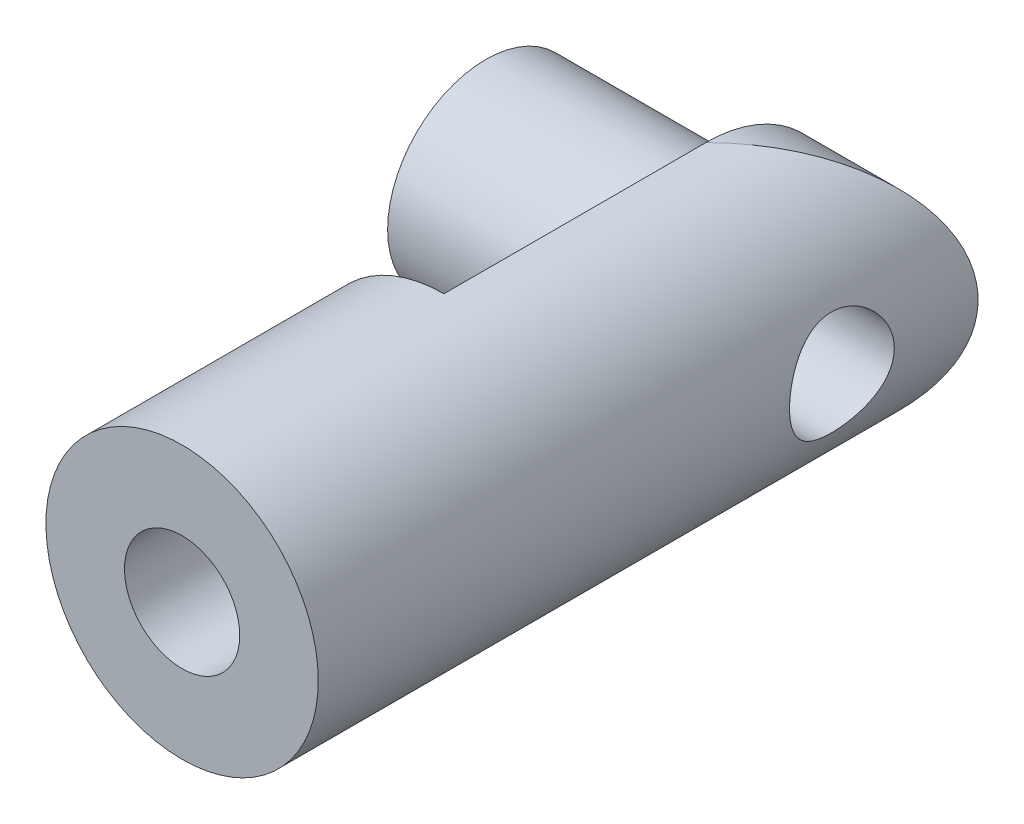
from build123d import *

# Parameters (mm, degrees)
SKETCH8_R                = 2.6
SKETCH8_R_2              = 1.1
BOSS_EXTRUDE2_DEPTH      = 5
BOSS_EXTRUDE3_REACH      = 8.206
BOSS_EXTRUDE3_END_RADIUS = 2.6
SKETCH10_R               = 1.875
BOSS_EXTRUDE4_DEPTH      = 4.2
SKETCH11_R               = 1
CUT_EXTRUDE1_DEPTH       = 11.524257694


with BuildPart() as part:
    # Sketch8 → Boss-Extrude2 (new body)
    with BuildSketch(Plane.XY):
        Circle(SKETCH8_R)
        Circle(SKETCH8_R_2, mode=Mode.SUBTRACT)
    extrude(amount=BOSS_EXTRUDE2_DEPTH)

    # Boss-Extrude3: up to this cylinder (the profile starts inside it)
    boss_extrude3_end = Plane(origin=(0, 0, -3.544928), z_dir=(0, 0, -1)) * Cylinder(BOSS_EXTRUDE3_END_RADIUS, 22.612, mode=Mode.PRIVATE)
    # Sketch9 → Boss-Extrude3 (add, up to the surface)
    with BuildSketch(Plane(origin=(0, 0, 0), x_dir=(0, 0, -1), z_dir=(1, 0, 0)), mode=Mode.PRIVATE) as boss_extrude3_sk1:
        with BuildLine():
            Line((0, 2.6), (5, 2.6))
            ThreePointArc((5, 2.6), (7.6, 0), (5, -2.6))
            Line((5, -2.6), (0, -2.6))
            Line((0, -2.6), (0, 2.6))
        make_face()
    boss_extrude3_tool1 = extrude(boss_extrude3_sk1.sketch, amount=BOSS_EXTRUDE3_REACH, mode=Mode.PRIVATE) & boss_extrude3_end
    add(boss_extrude3_tool1.solids().sort_by_distance((0, 0, -3.544928))[0])

    # Sketch10 → Boss-Extrude4 (add)
    with BuildSketch(Plane.ZY):
        with Locations((-5, 0)):
            Circle(SKETCH10_R)
    extrude(amount=BOSS_EXTRUDE4_DEPTH)

    # Sketch11 → Cut-Extrude1 (cut, through all)
    with BuildSketch(Plane.ZY.offset(4.2)):
        with Locations((-5, 0)):
            Circle(SKETCH11_R)
    extrude(amount=-CUT_EXTRUDE1_DEPTH, mode=Mode.SUBTRACT)


solid = part.part
